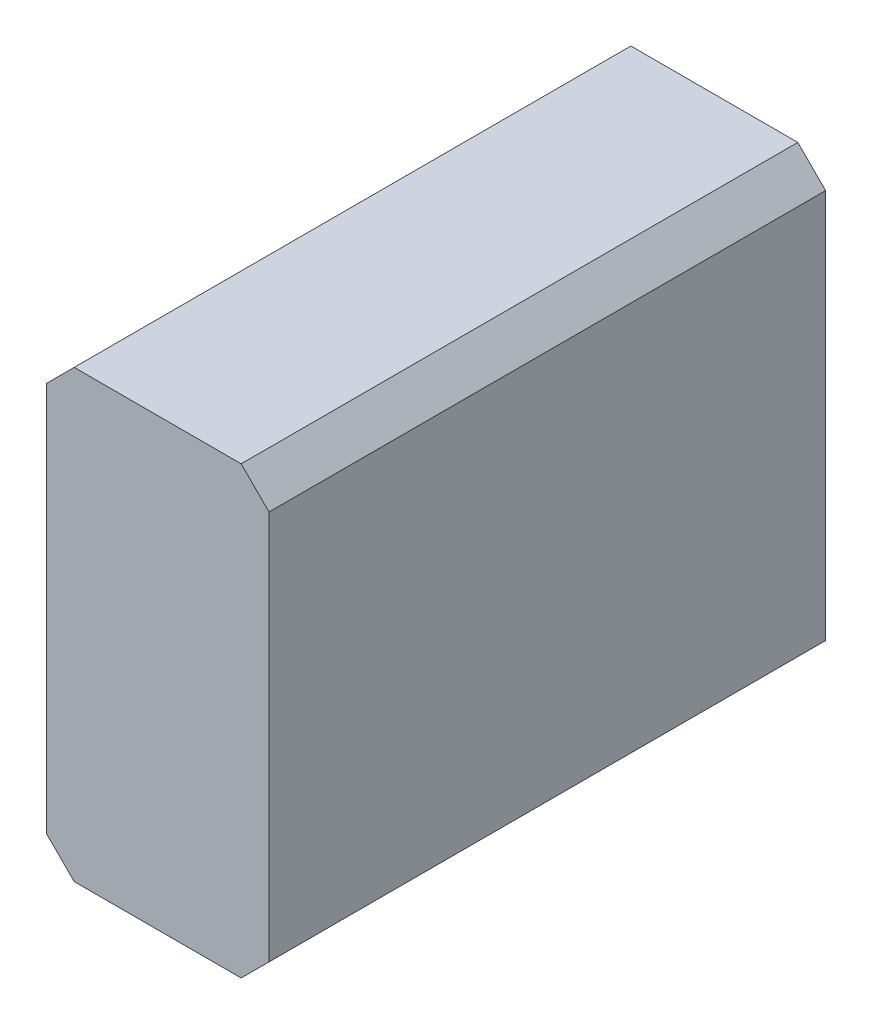
from build123d import *

# Parameters (mm, degrees)
SKETCH1_W           = 4
SKETCH1_H           = 8
BOSS_EXTRUDE1_DEPTH = 10
CHAMFER1_SIZE       = 0.5


with BuildPart() as part:
    # Sketch1 → Boss-Extrude1 (new body)
    with BuildSketch(Plane.XY):
        Rectangle(SKETCH1_W, SKETCH1_H)
    extrude(amount=BOSS_EXTRUDE1_DEPTH)

    # Chamfer1
    chamfer1_edges = [part.edges().sort_by_distance(p)[0] for p in [
        (-2, -4, 5),
        (2, -4, 5),
        (2, 4, 5),
        (-2, 4, 5),
    ]]
    chamfer(chamfer1_edges, length=CHAMFER1_SIZE)


solid = part.part
